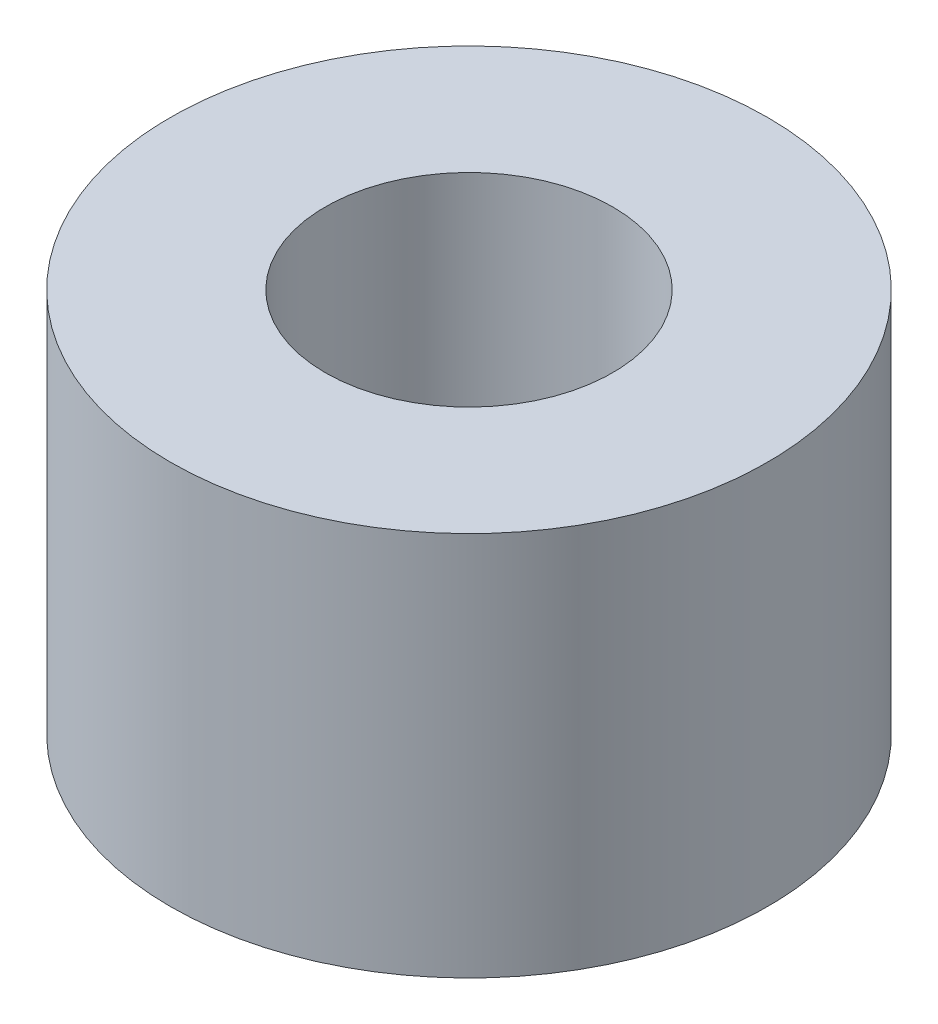
from build123d import *

# Parameters (mm, degrees)
SKETCH1_R           = 5.715
SKETCH1_R_2         = 2.75
BOSS_EXTRUDE1_DEPTH = 7.366


with BuildPart() as part:
    # Sketch1 → Boss-Extrude1 (new body)
    with BuildSketch(Plane(origin=(0, 0, 0), x_dir=(1, 0, 0), z_dir=(0, 1, 0))):
        Circle(SKETCH1_R)
        Circle(SKETCH1_R_2, mode=Mode.SUBTRACT)
    extrude(amount=BOSS_EXTRUDE1_DEPTH)


solid = part.part
